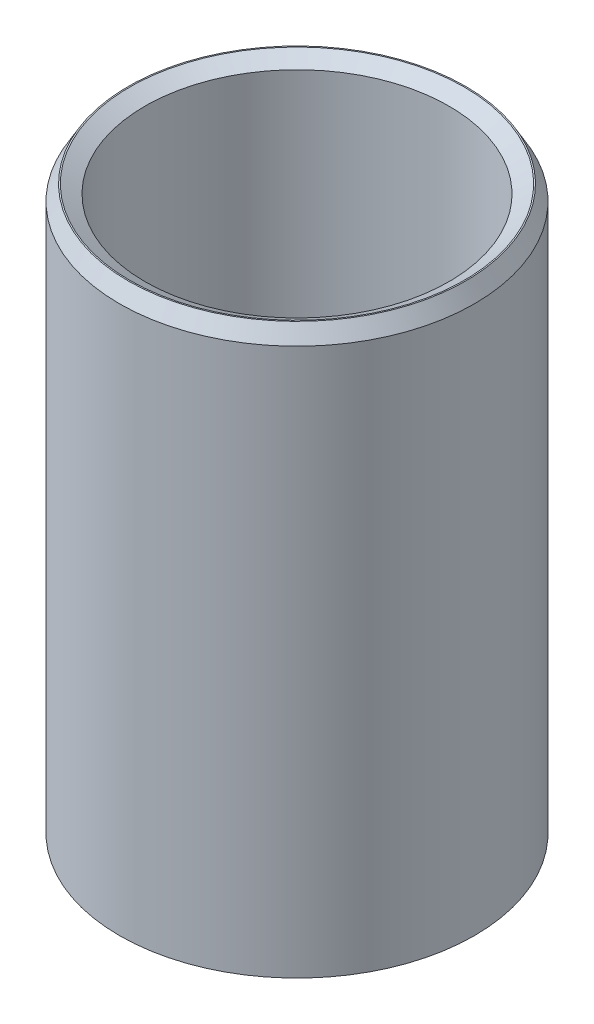
from build123d import *
from OCP.BRepFilletAPI import BRepFilletAPI_MakeChamfer

# Parameters (mm, degrees)
SKETCH1_R           = 27.5
BOSS_EXTRUDE1_DEPTH = 88.525676949
SKETCH2_R           = 23.559462782
CUT_EXTRUDE1_DEPTH  = 97.691754971
CHAMFER1_SIZE       = 2.369868022
CHAMFER1_SIZE2      = 1.368243941


with BuildPart() as part:
    # Sketch1 → Boss-Extrude1 (new body)
    with BuildSketch(Plane(origin=(0, 0, 0), x_dir=(1, 0, 0), z_dir=(0, 1, 0))):
        Circle(SKETCH1_R)
    extrude(amount=BOSS_EXTRUDE1_DEPTH)

    # Sketch2 → Cut-Extrude1 (cut, through all)
    with BuildSketch(Plane(origin=(0, 0, 0), x_dir=(1, 0, 0), z_dir=(0, 1, 0))):
        Circle(SKETCH2_R)
    extrude(amount=CUT_EXTRUDE1_DEPTH, mode=Mode.SUBTRACT)

    # Chamfer1: one chamfer whose edges measure the first distance from different faces: ONE call of the kernel's chamfer builder (chamfer() names one face for all edges)
    chamfer1_edges_1 = [part.edges().sort_by_distance(p)[0] for p in [
        (-23.559462782, 88.525676949, 0),
    ]]
    chamfer1_side_1 = [part.faces().sort_by_distance(p)[0] for p in [
        (-26.722182541, 88.525676949, 0),
    ]]
    chamfer1_edges_2 = [part.edges().sort_by_distance(p)[0] for p in [
        (-23.559462782, 0, 0),
    ]]
    chamfer1_side_2 = [part.faces().sort_by_distance(p)[0] for p in [
        (-23.559462782, 44.262838475, 0),
    ]]
    chamfer1_edges_3 = [part.edges().sort_by_distance(p)[0] for p in [
        (-27.5, 0, 0),
    ]]
    chamfer1_side_3 = [part.faces().sort_by_distance(p)[0] for p in [
        (-26.722182541, 0, 0),
    ]]
    chamfer1_edges_4 = [part.edges().sort_by_distance(p)[0] for p in [
        (-27.5, 88.525676949, 0),
    ]]
    chamfer1_side_4 = [part.faces().sort_by_distance(p)[0] for p in [
        (-27.5, 44.262838475, 0),
    ]]
    chamfer1 = BRepFilletAPI_MakeChamfer(part.part.solid().wrapped)
    for e in chamfer1_edges_1:
        chamfer1.Add(CHAMFER1_SIZE, CHAMFER1_SIZE2, e.wrapped, chamfer1_side_1[0].wrapped)  # the first distance lies on this face
    for e in chamfer1_edges_2:
        chamfer1.Add(CHAMFER1_SIZE, CHAMFER1_SIZE2, e.wrapped, chamfer1_side_2[0].wrapped)  # the first distance lies on this face
    for e in chamfer1_edges_3:
        chamfer1.Add(CHAMFER1_SIZE, CHAMFER1_SIZE2, e.wrapped, chamfer1_side_3[0].wrapped)  # the first distance lies on this face
    for e in chamfer1_edges_4:
        chamfer1.Add(CHAMFER1_SIZE, CHAMFER1_SIZE2, e.wrapped, chamfer1_side_4[0].wrapped)  # the first distance lies on this face
    add(Compound.cast(chamfer1.Shape()), mode=Mode.REPLACE)


solid = part.part
